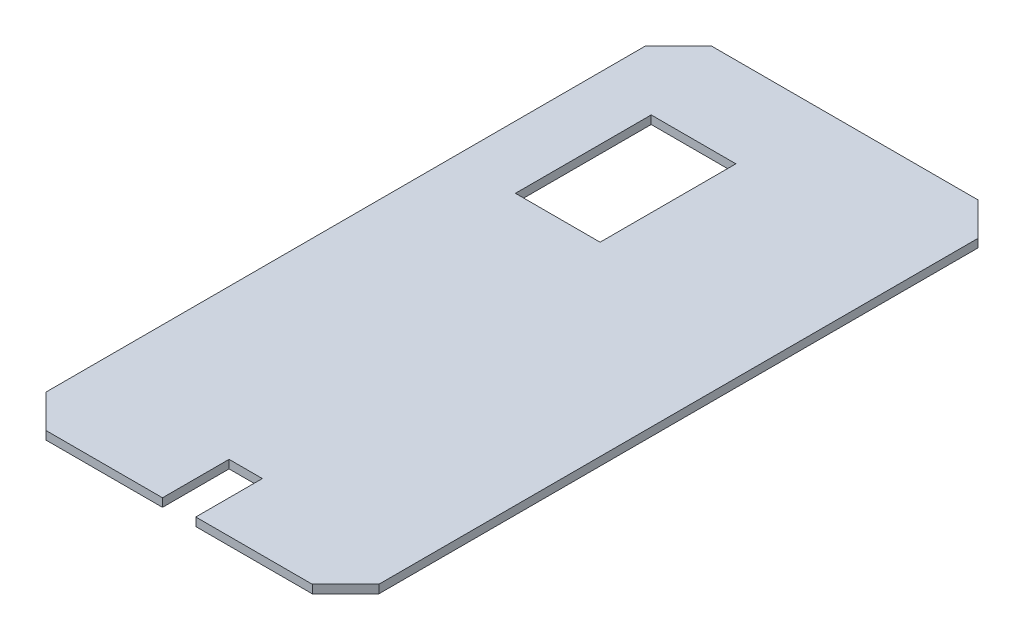
from build123d import *

# Parameters (mm, degrees)
SKETCH2_W           = 32.310298854
SKETCH2_H           = 51.805263964
BOSS_EXTRUDE1_DEPTH = 3.175


with BuildPart() as part:
    # Sketch2 → Boss-Extrude1 (new body)
    with BuildSketch(Plane(origin=(0, 0, 0), x_dir=(1, 0, 0), z_dir=(0, 1, 0))):
        Polygon((0, 241.3), (0, 12.7), (12.7, 0), (57.15, 0), (57.15, 25.4), (69.85, 25.4), (69.85, 0), (114.3, 0), (127, 12.7), (127, 241.3), (114.3, 254), (12.7, 254), align=None)
        with Locations((40.0288871, 193.832999444)):
            Rectangle(SKETCH2_W, SKETCH2_H, mode=Mode.SUBTRACT)
    extrude(amount=BOSS_EXTRUDE1_DEPTH)


solid = part.part
